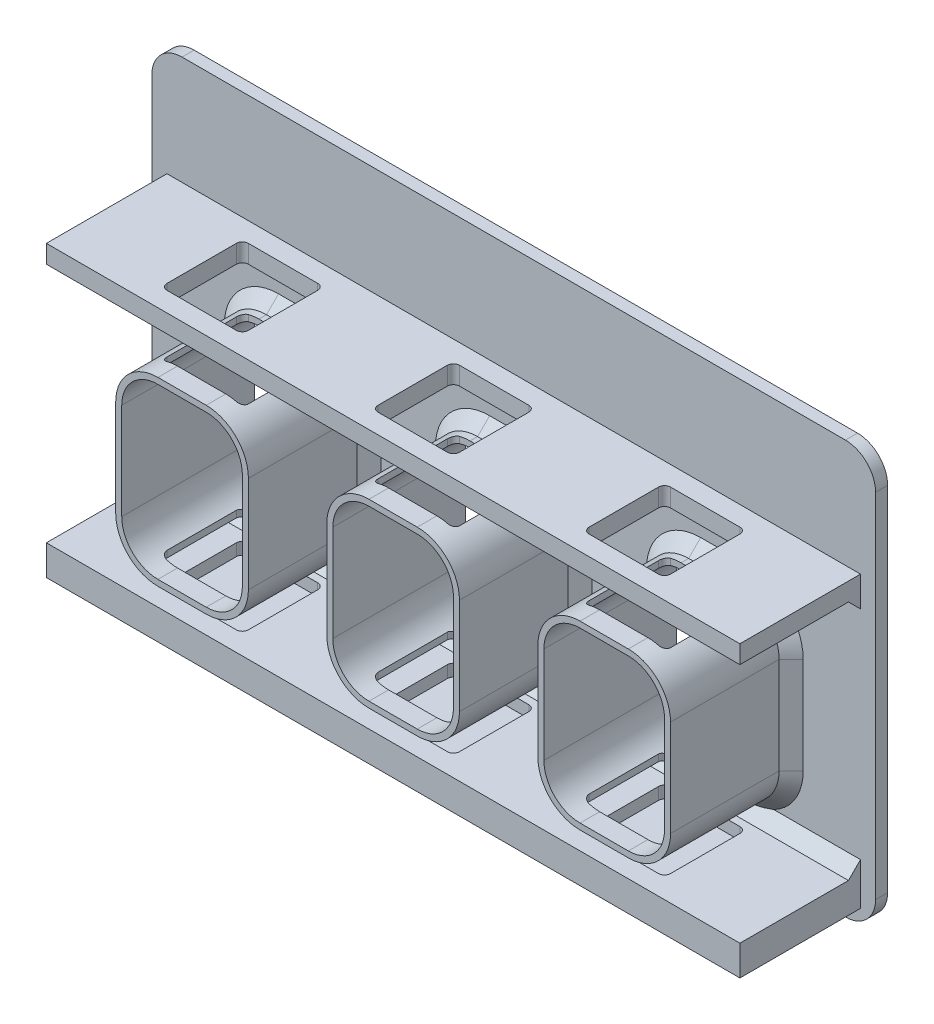
from build123d import *

# Parameters (mm, degrees)
SKETCH1_W           = 120
SKETCH1_H           = 75
BOSS_EXTRUDE1_DEPTH = 2
SKETCH2_W           = 115
SKETCH2_H           = 5
SKETCH2_H_2         = 3
BOSS_EXTRUDE2_DEPTH = 20
SKETCH3_W           = 20
SKETCH3_H           = 28
CUT_EXTRUDE1_DEPTH  = 20
SKETCH4_W           = 22
SKETCH4_H           = 30
SKETCH4_W_2         = 20
SKETCH4_H_2         = 28
BOSS_EXTRUDE3_DEPTH = 20
FILLET1_R           = 6
FILLET2_R           = 7
CUT_EXTRUDE2_DEPTH  = 45
SKETCH6_W           = 120
SKETCH6_H           = 6.5
CUT_EXTRUDE3_DEPTH  = 45
FILLET3_R           = 5
CHAMFER1_SIZE       = 2
CHAMFER2_SIZE       = 2
CHAMFER3_SIZE       = 2


with BuildPart() as part:
    # Sketch1 → Boss-Extrude1 (new body)
    with BuildSketch(Plane.XY):
        Rectangle(SKETCH1_W, SKETCH1_H)
    extrude(amount=BOSS_EXTRUDE1_DEPTH)

    # Sketch2 → Boss-Extrude2 (add)
    with BuildSketch(Plane.XY.offset(2)):
        with Locations((0, -32.5)):
            Rectangle(SKETCH2_W, SKETCH2_H)
        with Locations((0, 11.5)):
            Rectangle(SKETCH2_W, SKETCH2_H_2)
    extrude(amount=BOSS_EXTRUDE2_DEPTH)

    # Sketch3 → Cut-Extrude1 (cut)
    with BuildSketch(Plane.XY.offset(2)):
        with Locations((-35, -12)):
            Rectangle(SKETCH3_W, SKETCH3_H)
        with Locations((0, -12)):
            Rectangle(SKETCH3_W, SKETCH3_H)
        with Locations((35, -12)):
            Rectangle(SKETCH3_W, SKETCH3_H)
    extrude(amount=-CUT_EXTRUDE1_DEPTH, mode=Mode.SUBTRACT)

    # Sketch4 → Boss-Extrude3 (add)
    # profile 1 of 3: a face of its own
    with BuildSketch(Plane.XY.offset(2)):
        with Locations((-35, -12)):
            Rectangle(SKETCH4_W, SKETCH4_H)
        with Locations((-35, -12)):
            Rectangle(SKETCH4_W_2, SKETCH4_H_2, mode=Mode.SUBTRACT)
    # profile 2 of 3: a face of its own
    with BuildSketch(Plane.XY.offset(2)):
        with Locations((0, -12)):
            Rectangle(SKETCH4_W, SKETCH4_H)
        with Locations((0, -12)):
            Rectangle(SKETCH4_W_2, SKETCH4_H_2, mode=Mode.SUBTRACT)
    # profile 3 of 3: a face of its own
    with BuildSketch(Plane.XY.offset(2)):
        with Locations((35, -12)):
            Rectangle(SKETCH4_W, SKETCH4_H)
        with Locations((35, -12)):
            Rectangle(SKETCH4_W_2, SKETCH4_H_2, mode=Mode.SUBTRACT)
    extrude(amount=BOSS_EXTRUDE3_DEPTH)

    # Fillet1
    fillet1_edges = [part.edges().sort_by_distance(p)[0] for p in [
        (-45, -26, 11),
        (-45, 2, 11),
        (-25, 2, 11),
        (-25, -26, 11),
        (-10, -26, 11),
        (-10, 2, 11),
        (10, 2, 11),
        (10, -26, 11),
        (25, -26, 11),
        (25, 2, 11),
        (45, 2, 11),
        (45, -26, 11),
    ]]
    fillet(fillet1_edges, radius=FILLET1_R)

    # Fillet2
    fillet2_edges = [part.edges().sort_by_distance(p)[0] for p in [
        (-46, -27, 12),
        (-24, -27, 12),
        (-24, 3, 12),
        (-11, 3, 12),
        (-11, -27, 12),
        (11, -27, 12),
        (11, 3, 12),
        (24, 3, 12),
        (24, -27, 12),
        (46, -27, 12),
        (46, 3, 12),
        (-46, 3, 12),
    ]]
    fillet(fillet2_edges, radius=FILLET2_R)

    # Sketch5 → Cut-Extrude2 (cut)
    with BuildSketch(Plane(origin=(0, 13, 0), x_dir=(1, 0, 0), z_dir=(0, 1, 0))):
        with BuildLine():
            Line((40.75, -18.75), (29.25, -18.75))
            ThreePointArc((29.25, -18.75), (28.542893219, -18.457106781), (28.25, -17.75))
            Line((28.25, -17.75), (28.25, -6.25))
            ThreePointArc((28.25, -6.25), (28.542893219, -5.542893219), (29.25, -5.25))
            Line((29.25, -5.25), (40.75, -5.25))
            ThreePointArc((40.75, -5.25), (41.457106781, -5.542893219), (41.75, -6.25))
            Line((41.75, -6.25), (41.75, -17.75))
            ThreePointArc((41.75, -17.75), (41.457106781, -18.457106781), (40.75, -18.75))
        make_face()
        with BuildLine():
            Line((5.75, -18.75), (-5.75, -18.75))
            ThreePointArc((-5.75, -18.75), (-6.457106781, -18.457106781), (-6.75, -17.75))
            Line((-6.75, -17.75), (-6.75, -6.25))
            ThreePointArc((-6.75, -6.25), (-6.457106781, -5.542893219), (-5.75, -5.25))
            Line((-5.75, -5.25), (5.75, -5.25))
            ThreePointArc((5.75, -5.25), (6.457106781, -5.542893219), (6.75, -6.25))
            Line((6.75, -6.25), (6.75, -17.75))
            ThreePointArc((6.75, -17.75), (6.457106781, -18.457106781), (5.75, -18.75))
        make_face()
        with BuildLine():
            Line((-29.25, -18.75), (-40.75, -18.75))
            ThreePointArc((-40.75, -18.75), (-41.457106781, -18.457106781), (-41.75, -17.75))
            Line((-41.75, -17.75), (-41.75, -6.25))
            ThreePointArc((-41.75, -6.25), (-41.457106781, -5.542893219), (-40.75, -5.25))
            Line((-40.75, -5.25), (-29.25, -5.25))
            ThreePointArc((-29.25, -5.25), (-28.542893219, -5.542893219), (-28.25, -6.25))
            Line((-28.25, -6.25), (-28.25, -17.75))
            ThreePointArc((-28.25, -17.75), (-28.542893219, -18.457106781), (-29.25, -18.75))
        make_face()
    extrude(amount=-CUT_EXTRUDE2_DEPTH, mode=Mode.SUBTRACT)

    # Sketch6 → Cut-Extrude3 (cut)
    with BuildSketch(Plane.XY.offset(2)):
        with Locations((0, 34.25)):
            Rectangle(SKETCH6_W, SKETCH6_H)
    extrude(amount=-CUT_EXTRUDE3_DEPTH, mode=Mode.SUBTRACT)

    # Fillet3
    fillet3_edges = [part.edges().sort_by_distance(p)[0] for p in [
        (-60, 31, 1),
        (60, 31, 1),
        (60, -37.5, 1),
        (-60, -37.5, 1),
    ]]
    fillet(fillet3_edges, radius=FILLET3_R)

    # Chamfer1
    chamfer1_edges = [part.edges().sort_by_distance(p)[0] for p in [
        (0, 10, 2),
    ]]
    chamfer(chamfer1_edges, length=CHAMFER1_SIZE)

    # Chamfer2
    chamfer2_edges = [part.edges().sort_by_distance(p)[0] for p in [
        (46, -12, 2),
        (35, -27, 2),
        (35, 3, 2),
        (24, -12, 2),
        (11, -12, 2),
        (0, -27, 2),
        (0, 3, 2),
        (-11, -12, 2),
        (-35, -27, 2),
        (-46, -12, 2),
        (-24, -12, 2),
        (-35, 3, 2),
        (43.949747468, -24.949747468, 2),
        (43.949747468, 0.949747468, 2),
        (26.050252532, -24.949747468, 2),
        (26.050252532, 0.949747468, 2),
        (8.949747468, -24.949747468, 2),
        (8.949747468, 0.949747468, 2),
        (-8.949747468, 0.949747468, 2),
        (-8.949747468, -24.949747468, 2),
        (-43.949747468, -24.949747468, 2),
        (-26.050252532, -24.949747468, 2),
        (-26.050252532, 0.949747468, 2),
        (-43.949747468, 0.949747468, 2),
    ]]
    chamfer(chamfer2_edges, length=CHAMFER2_SIZE)

    # Chamfer3
    # the kernel refuses this chamfer: 2 mm, written as the material it adds along each edge
    with BuildSketch(Plane(origin=(57.5, -30, 2), x_dir=(0, 0.9996219169112968, -0.027495876610586403), z_dir=(-1, 0, 0))) as chamfer3_piece_1:
        Polygon((CHAMFER3_SIZE * 0.999621916911, -CHAMFER3_SIZE * 0.0274958766106), (-CHAMFER3_SIZE * 0.0274958766106, -CHAMFER3_SIZE * 0.999621916911), (0, 0), align=None)
    extrude(amount=115)


solid = part.part
